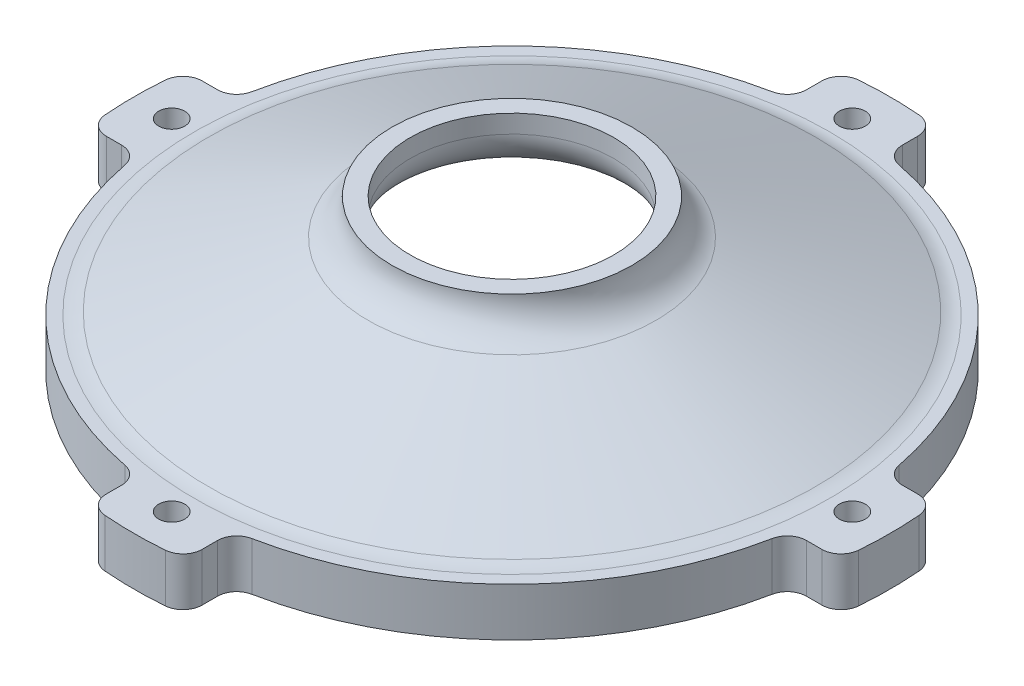
from build123d import *

# Parameters (mm, degrees)
F_18_0_1695_DIAMETER_HOLE1_D     = 4.3053
F_18_0_1695_DIAMETER_HOLE1_DEPTH = 38.1
F_18_0_1695_DIAMETER_HOLE1_TIP   = 1.293442612
CUT_EXTRUDE1_DEPTH               = 28


with BuildPart() as part:
    # Sketch2 → Revolve1 (revolve)
    with BuildSketch(Plane.XY):
        with BuildLine():
            Line((50, 0), (62.5, 0))
            Line((62.5, 0), (62.5, 7.982495649))
            Line((62.5, 7.982495649), (52.5, 7.982495649))
            ThreePointArc((52.5, 7.982495649), (51.285053929, 8.09980714), (50.114998295, 8.447407131))
            Line((50.114998295, 8.447407131), (23.792498295, 19.114911482))
            ThreePointArc((23.792498295, 19.114911482), (20.911227085, 21.451920296), (19.8275, 25))
            Line((19.8275, 25), (16.8275, 25))
            Line((16.8275, 25), (16.8275, 22))
            ThreePointArc((16.8275, 22), (17.911227085, 18.451920296), (20.792498295, 16.114911482))
            Line((20.792498295, 16.114911482), (46.035001705, 5.885088518))
            ThreePointArc((46.035001705, 5.885088518), (48.916272915, 3.548079704), (50, 0))
        make_face()
    revolve(axis=Axis((0, 0, 0), (0, 1, 0)))

    # #18 (0.1695) Diameter Hole1
    with Locations(Plane(origin=(0, 0, 0), x_dir=(-1, 0, 0), z_dir=(0, -1, 0))):
        with Locations((0, 56.25), (0, -56.25), (-56.25, 0), (56.25, 0)):
            Hole(F_18_0_1695_DIAMETER_HOLE1_D / 2, depth=F_18_0_1695_DIAMETER_HOLE1_DEPTH)
            with Locations((0, 0, -(F_18_0_1695_DIAMETER_HOLE1_DEPTH + F_18_0_1695_DIAMETER_HOLE1_TIP / 2))):  # 118° drill point
                Cone(0, F_18_0_1695_DIAMETER_HOLE1_D / 2, F_18_0_1695_DIAMETER_HOLE1_TIP, mode=Mode.SUBTRACT)

    # Sketch5 → Cut-Extrude1 (cut)
    with BuildSketch(Plane(origin=(0, 7.982495649, 0), x_dir=(1, 0, 0), z_dir=(0, 1, 0))):
        with BuildLine():
            Line((-56.597564918, 7.921), (-59.13485528, 7.921))
            ThreePointArc((-59.13485528, 7.921), (-61.28824505, 7.07913898), (-62.299678972, 5))
            ThreePointArc((-62.299678972, 5), (-44.194173824, 44.194173824), (-5, 62.299678972))
            ThreePointArc((-5, 62.299678972), (-7.07913898, 61.28824505), (-7.921, 59.13485528))
            Line((-7.921, 59.13485528), (-7.921, 56.597564918))
            ThreePointArc((-7.921, 56.597564918), (-8.644467964, 54.579988714), (-10.485166883, 53.48187801))
            ThreePointArc((-10.485166883, 53.48187801), (-38.537319575, 38.537319575), (-53.48187801, 10.485166883))
            ThreePointArc((-53.48187801, 10.485166883), (-54.579988714, 8.644467964), (-56.597564918, 7.921))
        make_face()
        with BuildLine():
            Line((7.921, 56.597564918), (7.921, 59.13485528))
            ThreePointArc((7.921, 59.13485528), (7.07913898, 61.28824505), (5, 62.299678972))
            ThreePointArc((5, 62.299678972), (44.194173824, 44.194173824), (62.299678972, 5))
            ThreePointArc((62.299678972, 5), (61.28824505, 7.07913898), (59.13485528, 7.921))
            Line((59.13485528, 7.921), (56.597564918, 7.921))
            ThreePointArc((56.597564918, 7.921), (54.579988714, 8.644467964), (53.48187801, 10.485166883))
            ThreePointArc((53.48187801, 10.485166883), (38.537319575, 38.537319575), (10.485166883, 53.48187801))
            ThreePointArc((10.485166883, 53.48187801), (8.644467964, 54.579988714), (7.921, 56.597564918))
        make_face()
        with BuildLine():
            Line((56.597564918, -7.921), (59.13485528, -7.921))
            ThreePointArc((59.13485528, -7.921), (61.28824505, -7.07913898), (62.299678972, -5))
            ThreePointArc((62.299678972, -5), (44.194173824, -44.194173824), (5, -62.299678972))
            ThreePointArc((5, -62.299678972), (7.07913898, -61.28824505), (7.921, -59.13485528))
            Line((7.921, -59.13485528), (7.921, -56.597564918))
            ThreePointArc((7.921, -56.597564918), (8.644467964, -54.579988714), (10.485166883, -53.48187801))
            ThreePointArc((10.485166883, -53.48187801), (38.537319575, -38.537319575), (53.48187801, -10.485166883))
            ThreePointArc((53.48187801, -10.485166883), (54.579988714, -8.644467964), (56.597564918, -7.921))
        make_face()
        with BuildLine():
            Line((-7.921, -56.597564918), (-7.921, -59.13485528))
            ThreePointArc((-7.921, -59.13485528), (-7.07913898, -61.28824505), (-5, -62.299678972))
            ThreePointArc((-5, -62.299678972), (-44.194173824, -44.194173824), (-62.299678972, -5))
            ThreePointArc((-62.299678972, -5), (-61.28824505, -7.07913898), (-59.13485528, -7.921))
            Line((-59.13485528, -7.921), (-56.597564918, -7.921))
            ThreePointArc((-56.597564918, -7.921), (-54.579988714, -8.644467964), (-53.48187801, -10.485166883))
            ThreePointArc((-53.48187801, -10.485166883), (-38.537319575, -38.537319575), (-10.485166883, -53.48187801))
            ThreePointArc((-10.485166883, -53.48187801), (-8.644467964, -54.579988714), (-7.921, -56.597564918))
        make_face()
    extrude(amount=-CUT_EXTRUDE1_DEPTH, mode=Mode.SUBTRACT)


solid = part.part
